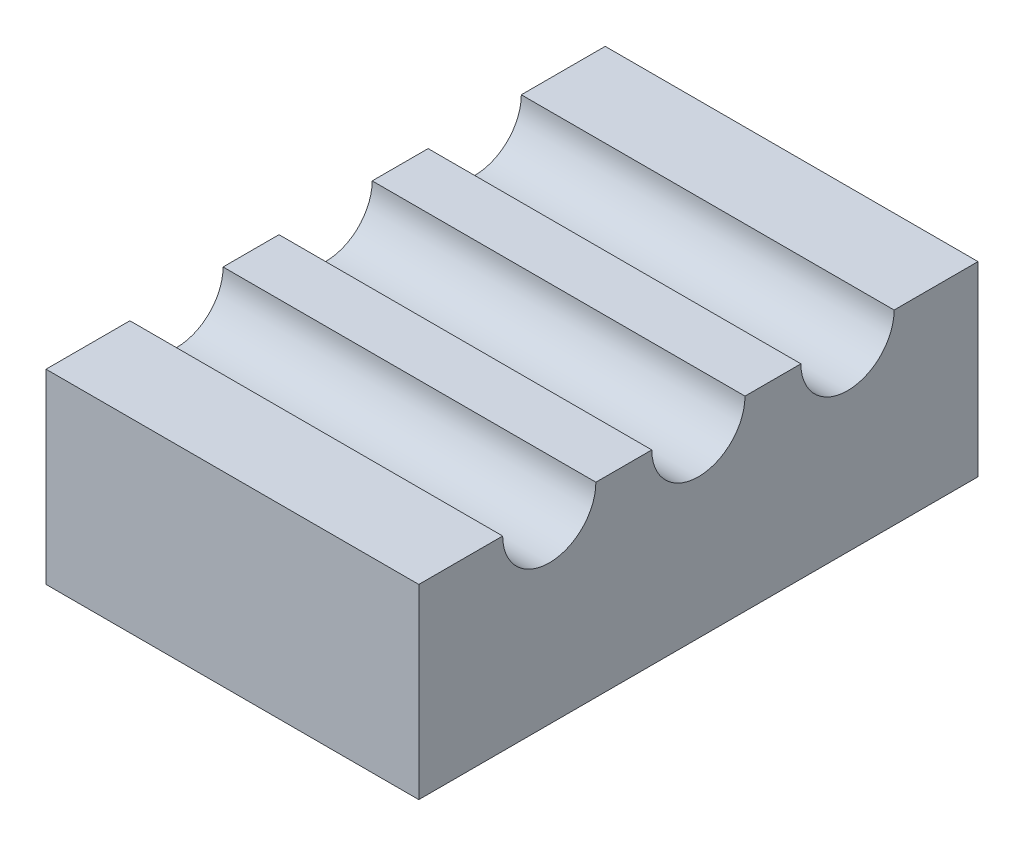
from build123d import *

# Parameters (mm, degrees)
SKETCH1_W           = 10
SKETCH1_H           = 15
BOSS_EXTRUDE1_DEPTH = 5
SKETCH2_R           = 1.25
CUT_EXTRUDE1_DEPTH  = 14.462912018


with BuildPart() as part:
    # Sketch1 → Boss-Extrude1 (new body)
    with BuildSketch(Plane(origin=(0, 0, 0), x_dir=(1, 0, 0), z_dir=(0, 1, 0))):
        Rectangle(SKETCH1_W, SKETCH1_H)
    extrude(amount=BOSS_EXTRUDE1_DEPTH)

    # Sketch2 → Cut-Extrude1 (cut, through all)
    with BuildSketch(Plane(origin=(5, 0, 0), x_dir=(0, 0, -1), z_dir=(1, 0, 0))):
        with Locations((0, 5)):
            Circle(SKETCH2_R)
        with Locations((-4, 5)):
            Circle(SKETCH2_R)
        with Locations((4, 5)):
            Circle(SKETCH2_R)
    extrude(amount=-CUT_EXTRUDE1_DEPTH, mode=Mode.SUBTRACT)


solid = part.part
